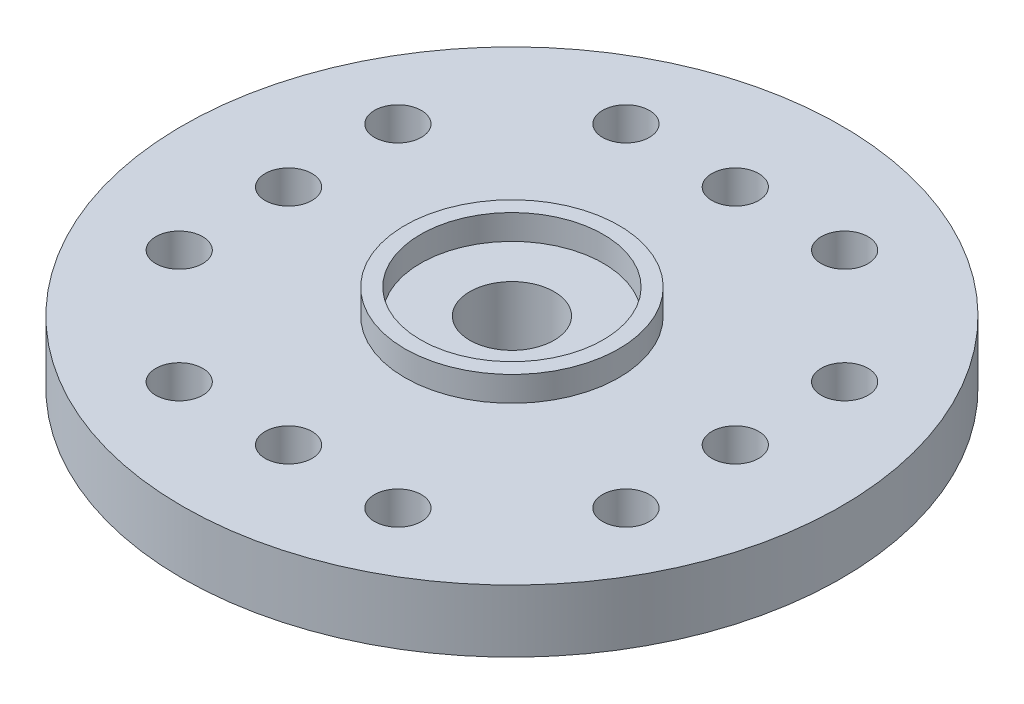
from build123d import *

# Parameters (mm, degrees)
SKETCH1_R                           = 4.35
REBAIXO_DE_ENCAIXE_DEPTH            = 2.6
SKETCH14_R                          = 2.45
FURO_DE_ENCAIXE_SERVO_DEPTH         = 3
SKETCH5_R                           = 10.55
SKETCH5_R_2                         = 1.35
BASE_REDONDA_DEPTH                  = 2
SKETCH8_R                           = 3.425
SKETCH8_R_2                         = 2.925
RESSALTO_DEPTH                      = 0.8
SKETCH9_R                           = 0.75
FUROS_DE_FIXA_O_CARGA_REDONDO_DEPTH = 16.612975373


with BuildPart() as part:
    # Sketch1 → Rebaixo de Encaixe (new body)
    with BuildSketch(Plane(origin=(0, 0, 0), x_dir=(1, 0, 0), z_dir=(0, 1, 0))):
        Circle(SKETCH1_R)
    extrude(amount=REBAIXO_DE_ENCAIXE_DEPTH)

    # Sketch14 → Furo de Encaixe - Servo (cut)
    with BuildSketch(Plane.XZ):
        Circle(SKETCH14_R)
    extrude(amount=-FURO_DE_ENCAIXE_SERVO_DEPTH, mode=Mode.SUBTRACT)

    # Sketch5 → Base Redonda (add)
    with BuildSketch(Plane(origin=(0, 2.6, 0), x_dir=(1, 0, 0), z_dir=(0, 1, 0))):
        Circle(SKETCH5_R)
        Circle(SKETCH5_R_2, mode=Mode.SUBTRACT)
    extrude(amount=BASE_REDONDA_DEPTH)

    # Sketch8 → Ressalto (add)
    with BuildSketch(Plane(origin=(0, 4.6, 0), x_dir=(1, 0, 0), z_dir=(0, 1, 0))):
        Circle(SKETCH8_R)
        Circle(SKETCH8_R_2, mode=Mode.SUBTRACT)
    extrude(amount=RESSALTO_DEPTH)

    # Sketch9 → Furos de Fixação - Carga Redondo (cut, through all)
    with BuildSketch(Plane(origin=(0, 4.6, 0), x_dir=(1, 0, 0), z_dir=(0, 1, 0))):
        with Locations((0, 7.15)):
            Circle(SKETCH9_R)
        with Locations((3.5, 7.15)):
            Circle(SKETCH9_R)
        with Locations((-3.5, 7.15)):
            Circle(SKETCH9_R)
        with Locations((7.15, 3.5)):
            Circle(SKETCH9_R)
        with Locations((7.15, 0)):
            Circle(SKETCH9_R)
        with Locations((7.15, -3.5)):
            Circle(SKETCH9_R)
        with Locations((3.5, -7.15)):
            Circle(SKETCH9_R)
        with Locations((0, -7.15)):
            Circle(SKETCH9_R)
        with Locations((-3.5, -7.15)):
            Circle(SKETCH9_R)
        with Locations((-7.15, -3.5)):
            Circle(SKETCH9_R)
        with Locations((-7.15, 0)):
            Circle(SKETCH9_R)
        with Locations((-7.15, 3.5)):
            Circle(SKETCH9_R)
    extrude(amount=-FUROS_DE_FIXA_O_CARGA_REDONDO_DEPTH, mode=Mode.SUBTRACT)


solid = part.part
